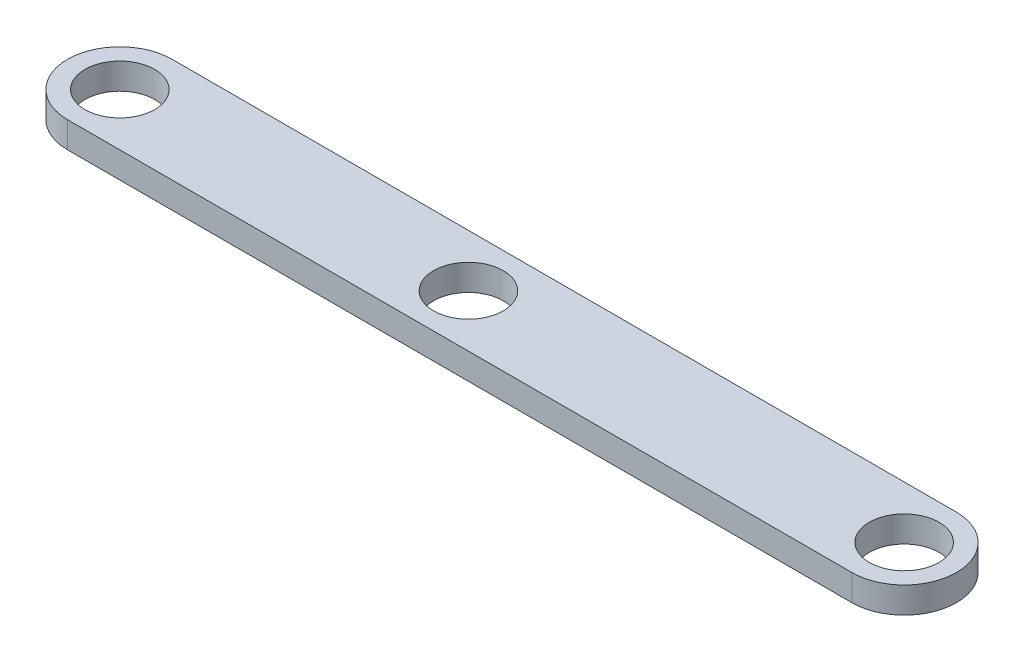
from build123d import *

# Parameters (mm, degrees)
SKETCH1_R           = 4
BOSS_EXTRUDE1_DEPTH = 3
SKETCH2_R           = 4
CUT_EXTRUDE1_DEPTH  = 97.234089594


with BuildPart() as part:
    # Sketch1 → Boss-Extrude1 (new body)
    with BuildSketch(Plane(origin=(0, 0, 0), x_dir=(1, 0, 0), z_dir=(0, 1, 0))):
        with BuildLine():
            Line((0, 6), (90, 6))
            ThreePointArc((90, 6), (96, 0), (90, -6))
            Line((90, -6), (0, -6))
            ThreePointArc((0, -6), (-6, 0), (0, 6))
        make_face()
        Circle(SKETCH1_R, mode=Mode.SUBTRACT)
        with Locations((90, 0)):
            Circle(SKETCH1_R, mode=Mode.SUBTRACT)
    extrude(amount=BOSS_EXTRUDE1_DEPTH)

    # Sketch2 → Cut-Extrude1 (cut, through all)
    with BuildSketch(Plane(origin=(0, 3, 0), x_dir=(1, 0, 0), z_dir=(0, 1, 0))):
        with Locations((40, 0)):
            Circle(SKETCH2_R)
    extrude(amount=-CUT_EXTRUDE1_DEPTH, mode=Mode.SUBTRACT)


solid = part.part
